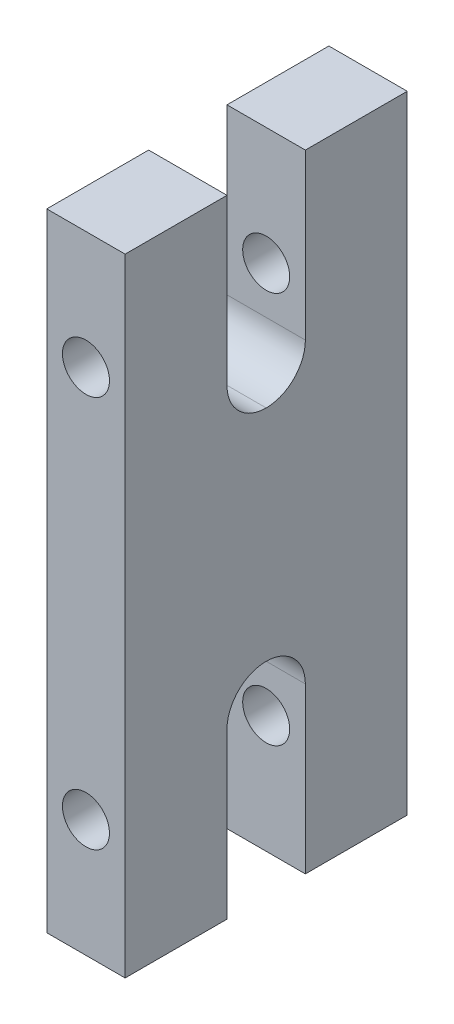
from build123d import *

# Parameters (mm, degrees)
EXTRUDE_1_DEPTH     = 5
SKETCH_2_R          = 1.5
CUT_EXTRUDE_1_DEPTH = 21
FILLET_1_R          = 2.5


with BuildPart() as part:
    # 草图1 → 凸台-拉伸1 (new body)
    with BuildSketch(Plane(origin=(0, 0, 0), x_dir=(0, 0, -1), z_dir=(1, 0, 0))):
        Polygon((-2.5, 20), (-2.5, 7), (2.5, 7), (2.5, 20), (9, 20), (9, -20), (2.5, -20), (2.5, -7), (-2.5, -7), (-2.5, -20), (-9, -20), (-9, 20), align=None)
    extrude(amount=EXTRUDE_1_DEPTH)

    # 草图2 → 切除-拉伸1 (cut)
    with BuildSketch(Plane.XY.offset(9)):
        with Locations((2.5, 12.5)):
            Circle(SKETCH_2_R)
        with Locations(Location((2.5, -12.5, 0), (0, 0, 270))):
            Circle(SKETCH_2_R)
    extrude(amount=-CUT_EXTRUDE_1_DEPTH, mode=Mode.SUBTRACT)

    # 圆角1
    fillet_1_edges = [part.edges().sort_by_distance(p)[0] for p in [
        (2.5, 7, -2.5),
        (2.5, 7, 2.5),
        (2.5, -7, -2.5),
        (2.5, -7, 2.5),
    ]]
    fillet(fillet_1_edges, radius=FILLET_1_R - 0.0001)  # a hair under: the kernel refuses the full size


solid = part.part
